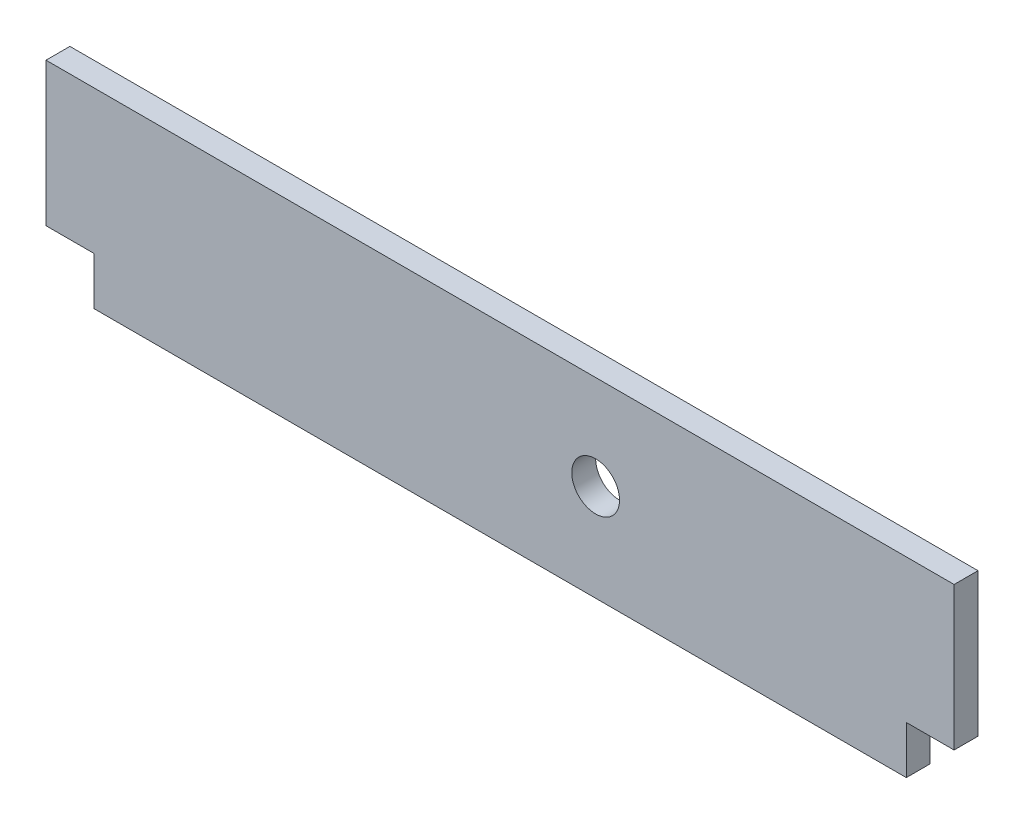
from build123d import *

# Parameters (mm, degrees)
BOSS_EXTRUDE1_DEPTH = 6.35
CAVITY1_START       = -6.35
CAVITY1_OUTLINE_R   = 12.7
CAVITY1_DEPTH       = 12.7


# Read off the part's stored shape, not the designer's step: Cavity1
with BuildPart() as part:
    # Sketch1 → Boss-Extrude1 (new, symmetric)
    with BuildSketch(Plane.XY):
        Polygon((-215.9, 0), (215.9, 0), (215.9, 25.4), (241.3, 25.4), (241.3, 101.6), (-241.3, 101.6), (-241.3, 25.4), (-215.9, 25.4), align=None)
    extrude(amount=BOSS_EXTRUDE1_DEPTH, both=True)

    # Cavity1 outline → Cavity1 (cut)
    with BuildSketch(Plane.XY.offset(CAVITY1_START)):
        with Locations((50.8, 51.5)):
            Circle(CAVITY1_OUTLINE_R)
    extrude(amount=CAVITY1_DEPTH, mode=Mode.SUBTRACT)


solid = part.part
